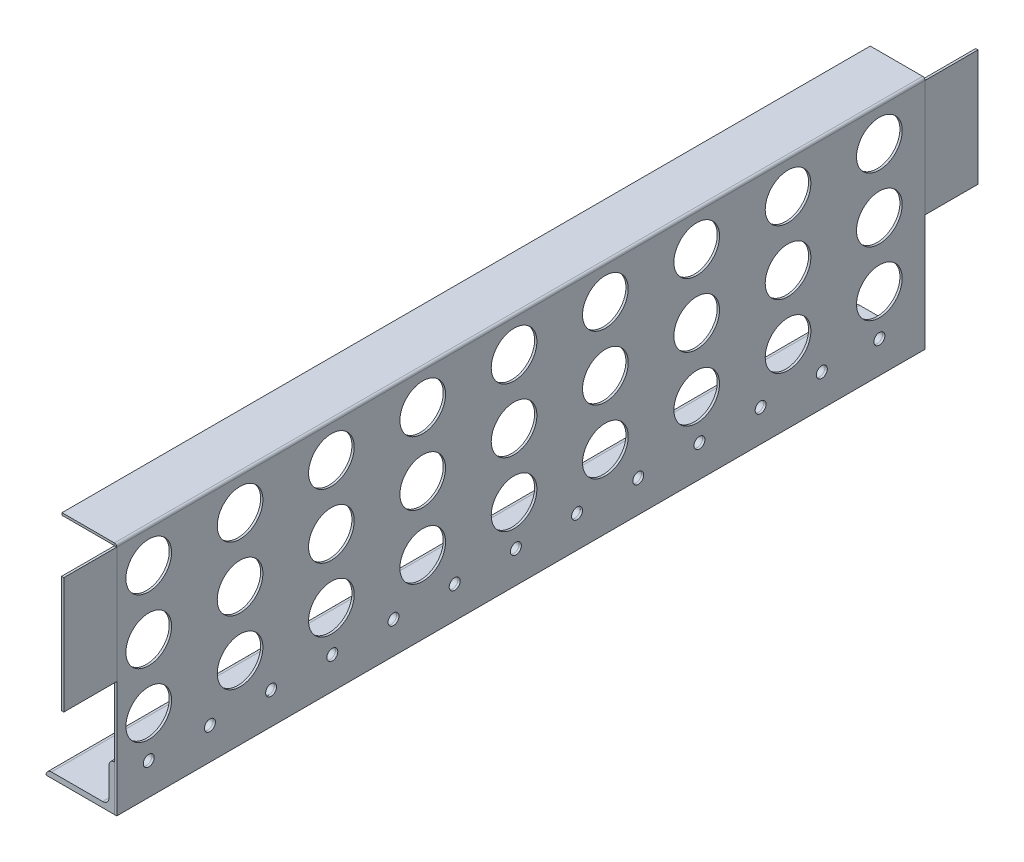
from build123d import *

# Parameters (mm, degrees)
L_ANGLE_UNEQUAL_75X50X6_1_DEPTH = 885
SKETCH12_W                      = 2.5
SKETCH12_H                      = 885
BASE_FLANGE1_DEPTH              = 255
CUT_EXTRUDE1_DEPTH              = 925.259839006
CUT_EXTRUDE1_DEPTH_BACK         = 925.259839006
SKETCH17_R                      = 25
CUT_EXTRUDE2_DEPTH              = 925.259839006
CUT_EXTRUDE2_DEPTH_BACK         = 925.259839006
SKETCH18_R                      = 6
SKETCH19_W                      = 2.5
SKETCH19_H                      = 127.5
BASE_FLANGE2_DEPTH              = 58
SKETCH26_W                      = 2.5
SKETCH26_H                      = 127.5
BASE_FLANGE4_DEPTH              = 58
EDGE_FLANGE1_DEPTH              = 885


# Sheet-metal steps are written as plain solids
with BuildPart() as part:
    # Sketch11 → L angle (unequal) 75X50X6(1) (new body)
    with BuildSketch(Plane(origin=(0, 0, 0), x_dir=(0, 1, 0), z_dir=(0, 0, 1))):
        with BuildLine():
            Line((0, 75), (0, 0))
            Line((0, 0), (50, 0))
            ThreePointArc((50, 0), (48.242640687, 4.242640687), (44, 6))
            Line((44, 6), (13, 6))
            ThreePointArc((13, 6), (8.050252532, 8.050252532), (6, 13))
            Line((6, 13), (6, 69))
            ThreePointArc((6, 69), (4.242640687, 73.242640687), (0, 75))
        make_face()
    extrude(amount=-L_ANGLE_UNEQUAL_75X50X6_1_DEPTH)


with BuildPart() as body_2:
    # Sketch12 → Base-Flange1 (new body)
    with BuildSketch(Plane(origin=(0, 0, 0), x_dir=(1, 0, 0), z_dir=(0, 1, 0))):
        with Locations((1.25, 442.5)):
            Rectangle(SKETCH12_W, SKETCH12_H)
    extrude(amount=BASE_FLANGE1_DEPTH)

    # Sketch17 → Cut-Extrude1 (cut, two sides: drawn at the far end of the back side and taken through both)
    with BuildSketch(Plane(origin=(2.5, 0, 0), x_dir=(0, 0, -1), z_dir=(1, 0, 0)).offset(-CUT_EXTRUDE1_DEPTH_BACK)):
        with Locations(Location((35, 220, 0), (0, 0, 180))):
            Circle(SKETCH17_R)
        with Locations(Location((135, 220, 0), (0, 0, 180))):
            Circle(SKETCH17_R)
        with Locations(Location((235, 220, 0), (0, 0, 180))):
            Circle(SKETCH17_R)
        with Locations(Location((335, 220, 0), (0, 0, 180))):
            Circle(SKETCH17_R)
        with Locations(Location((435, 220, 0), (0, 0, 180))):
            Circle(SKETCH17_R)
        with Locations(Location((535, 220, 0), (0, 0, 180))):
            Circle(SKETCH17_R)
        with Locations(Location((635, 220, 0), (0, 0, 180))):
            Circle(SKETCH17_R)
        with Locations(Location((735, 220, 0), (0, 0, 180))):
            Circle(SKETCH17_R)
        with Locations(Location((835, 220, 0), (0, 0, 180))):
            Circle(SKETCH17_R)
        with Locations(Location((35, 150, 0), (0, 0, 180))):
            Circle(SKETCH17_R)
        with Locations(Location((135, 150, 0), (0, 0, 180))):
            Circle(SKETCH17_R)
        with Locations(Location((235, 150, 0), (0, 0, 180))):
            Circle(SKETCH17_R)
        with Locations(Location((335, 150, 0), (0, 0, 180))):
            Circle(SKETCH17_R)
        with Locations(Location((435, 150, 0), (0, 0, 180))):
            Circle(SKETCH17_R)
        with Locations(Location((535, 150, 0), (0, 0, 180))):
            Circle(SKETCH17_R)
        with Locations(Location((635, 150, 0), (0, 0, 180))):
            Circle(SKETCH17_R)
        with Locations(Location((735, 150, 0), (0, 0, 180))):
            Circle(SKETCH17_R)
        with Locations(Location((835, 150, 0), (0, 0, 180))):
            Circle(SKETCH17_R)
        with Locations(Location((35, 80, 0), (0, 0, 180))):
            Circle(SKETCH17_R)
        with Locations(Location((135, 80, 0), (0, 0, 180))):
            Circle(SKETCH17_R)
        with Locations(Location((235, 80, 0), (0, 0, 180))):
            Circle(SKETCH17_R)
        with Locations(Location((335, 80, 0), (0, 0, 180))):
            Circle(SKETCH17_R)
        with Locations(Location((435, 80, 0), (0, 0, 180))):
            Circle(SKETCH17_R)
        with Locations(Location((535, 80, 0), (0, 0, 180))):
            Circle(SKETCH17_R)
        with Locations(Location((635, 80, 0), (0, 0, 180))):
            Circle(SKETCH17_R)
        with Locations(Location((735, 80, 0), (0, 0, 180))):
            Circle(SKETCH17_R)
        with Locations(Location((835, 80, 0), (0, 0, 180))):
            Circle(SKETCH17_R)
    extrude(amount=CUT_EXTRUDE1_DEPTH + CUT_EXTRUDE1_DEPTH_BACK, mode=Mode.SUBTRACT)


with BuildPart() as cut_extrude2_tool:
    # Sketch18 → Cut-Extrude2 (new, two sides: drawn at the far end of the back side and taken through both)
    with BuildSketch(Plane(origin=(2.5, 0, 0), x_dir=(0, 0, -1), z_dir=(1, 0, 0)).offset(-CUT_EXTRUDE2_DEPTH_BACK)):
        with Locations(Location((35, 35, 0), (0, 0, 180))):
            Circle(SKETCH18_R)
        with Locations(Location((835, 35, 0), (0, 0, 180))):
            Circle(SKETCH18_R)
        with Locations(Location((102, 35, 0), (0, 0, 180))):
            Circle(SKETCH18_R)
        with Locations(Location((169, 35, 0), (0, 0, 180))):
            Circle(SKETCH18_R)
        with Locations(Location((236, 35, 0), (0, 0, 180))):
            Circle(SKETCH18_R)
        with Locations(Location((303, 35, 0), (0, 0, 180))):
            Circle(SKETCH18_R)
        with Locations(Location((370, 35, 0), (0, 0, 180))):
            Circle(SKETCH18_R)
        with Locations(Location((437, 35, 0), (0, 0, 180))):
            Circle(SKETCH18_R)
        with Locations(Location((504, 35, 0), (0, 0, 180))):
            Circle(SKETCH18_R)
        with Locations(Location((571, 35, 0), (0, 0, 180))):
            Circle(SKETCH18_R)
        with Locations(Location((638, 35, 0), (0, 0, 180))):
            Circle(SKETCH18_R)
        with Locations(Location((705, 35, 0), (0, 0, 180))):
            Circle(SKETCH18_R)
        with Locations(Location((772, 35, 0), (0, 0, 180))):
            Circle(SKETCH18_R)
    extrude(amount=CUT_EXTRUDE2_DEPTH + CUT_EXTRUDE2_DEPTH_BACK)


with BuildPart() as part_1:
    add(part.part)

    # Cut-Extrude2: cut by cut_extrude2_tool
    add(cut_extrude2_tool.part, mode=Mode.SUBTRACT)


with BuildPart() as body_2_1:
    add(body_2.part)

    # Cut-Extrude2: cut by cut_extrude2_tool
    add(cut_extrude2_tool.part, mode=Mode.SUBTRACT)

    # Edge-Flange1 section (across the edge) → Edge-Flange1 (add)
    with BuildSketch(Plane(origin=(0, 255.1, 0), x_dir=(0, -1, 0), z_dir=(0, 0, -1))):
        with BuildLine():
            Line((-2.5, 0.1), (-2.5, 57.5))
            Line((-2.5, 57.5), (0, 57.5))
            Line((0, 57.5), (0, 0.1))
            ThreePointArc((0, 0.1), (0.029289322, 0.029289322), (0.1, 0))
            Line((0.1, 0), (0.1, -2.5))
            ThreePointArc((0.1, -2.5), (-1.738477631, -1.738477631), (-2.5, 0.1))
        make_face()
    extrude(amount=EDGE_FLANGE1_DEPTH)


with BuildPart() as body_3:
    # Sketch19 → Base-Flange2 (new body)
    with BuildSketch(Plane.XY):
        with Locations((1.25, 191.25)):
            Rectangle(SKETCH19_W, SKETCH19_H)
    extrude(amount=BASE_FLANGE2_DEPTH)


with BuildPart() as body_4:
    # Sketch26 → Base-Flange4 (new body)
    with BuildSketch(Plane(origin=(0, 0, -885), x_dir=(-1, 0, 0), z_dir=(0, 0, -1))):
        with Locations((-1.25, 191.25)):
            Rectangle(SKETCH26_W, SKETCH26_H)
    extrude(amount=BASE_FLANGE4_DEPTH)


solid = Compound([part_1.part, body_2_1.part, body_3.part, body_4.part])
